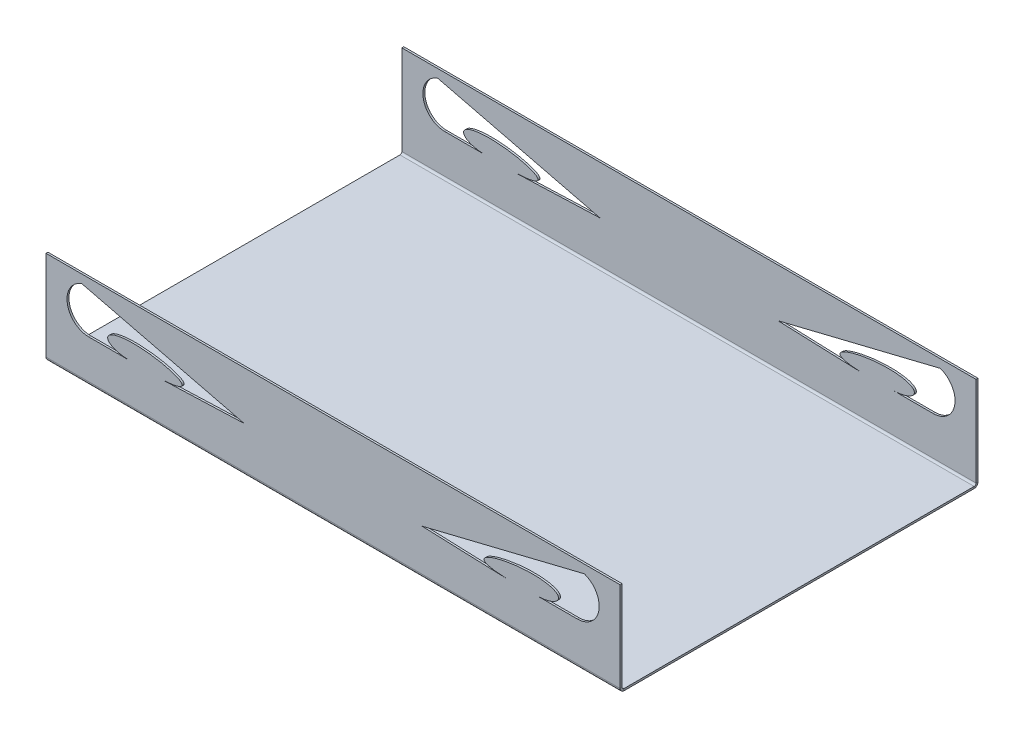
from build123d import *

# Parameters (mm, degrees)
SKETCH1_W                      = 219
SKETCH1_H                      = 135
BASE_FLANGE1_DEPTH             = 0.7366
EDGE_FLANGE1_STRIP_W           = 4.4196
EDGE_FLANGE1_STRIP_H           = 0.7366
EDGE_FLANGE1_STRIP_CUT_DEPTH   = 219
EDGE_FLANGE1_STRIP_2_W         = 4.4196
EDGE_FLANGE1_STRIP_2_H         = 0.7366
EDGE_FLANGE1_STRIP_CUT_2_DEPTH = 219
EDGE_FLANGE1_DEPTH             = 219
EDGE_FLANGE1_BEND_DEPTH        = 219
CUT_EXTRUDE1_DEPTH             = 179.438180663


# Sheet-metal steps are written as plain solids
with BuildPart() as part:
    # Sketch1 → Base-Flange1 (new body)
    with BuildSketch(Plane(origin=(0, 0, 0), x_dir=(1, 0, 0), z_dir=(0, 1, 0))):
        Rectangle(SKETCH1_W, SKETCH1_H)
    extrude(amount=-BASE_FLANGE1_DEPTH)

    # Edge-Flange1 strip (across the edge) → Edge-Flange1 strip cut (cut)
    with BuildSketch(Plane(origin=(-109.5, 0, 67.5), x_dir=(0, 0, -1), z_dir=(1, 0, 0))):
        with Locations((-1.4732, -0.3683)):
            Rectangle(EDGE_FLANGE1_STRIP_W, EDGE_FLANGE1_STRIP_H)
    extrude(amount=EDGE_FLANGE1_STRIP_CUT_DEPTH, mode=Mode.SUBTRACT)

    # Edge-Flange1 strip 2 (across the edge) → Edge-Flange1 strip cut 2 (cut)
    with BuildSketch(Plane(origin=(109.5, 0, -67.5), x_dir=(0, 0, 1), z_dir=(-1, 0, 0))):
        with Locations((-1.4732, -0.3683)):
            Rectangle(EDGE_FLANGE1_STRIP_2_W, EDGE_FLANGE1_STRIP_2_H)
    extrude(amount=EDGE_FLANGE1_STRIP_CUT_2_DEPTH, mode=Mode.SUBTRACT)

    # Edge-Flange1 section (across the edge) → Edge-Flange1 (add)
    with BuildSketch(Plane(origin=(-109.5, 0, 67.5), x_dir=(0, 0, -1), z_dir=(1, 0, 0))):
        with BuildLine():
            Line((-0.7366, 0.7366), (-0.7366, 35))
            Line((-0.7366, 35), (0, 35))
            Line((0, 35), (0, 0.7366))
            ThreePointArc((0, 0.7366), (0.215745145, 0.215745145), (0.7366, 0))
            Line((0.7366, 0), (0.7366, -0.7366))
            ThreePointArc((0.7366, -0.7366), (-0.30510971, -0.30510971), (-0.7366, 0.7366))
        make_face()
    extrude(amount=EDGE_FLANGE1_DEPTH)

    # Edge-Flange1 section 2 (across the edge) → Edge-Flange1 bend (add)
    with BuildSketch(Plane(origin=(109.5, 0, -67.5), x_dir=(0, 0, 1), z_dir=(-1, 0, 0))):
        with BuildLine():
            Line((-0.7366, 0.7366), (-0.7366, 35))
            Line((-0.7366, 35), (0, 35))
            Line((0, 35), (0, 0.7366))
            ThreePointArc((0, 0.7366), (0.215745145, 0.215745145), (0.7366, 0))
            Line((0.7366, 0), (0.7366, -0.7366))
            ThreePointArc((0.7366, -0.7366), (-0.30510971, -0.30510971), (-0.7366, 0.7366))
        make_face()
    extrude(amount=EDGE_FLANGE1_BEND_DEPTH)

    # Sketch13 → Cut-Extrude1 (cut, through all)
    with BuildSketch(Plane.XY.offset(68.2366)):
        with BuildLine():
            Line((77.825189915, 15.538033098), (93.129236627, 15.538033098))
            ThreePointArc((93.129236627, 15.538033098), (101.370995393, 22.515880602), (95.848230578, 31.795751945))
            Line((95.848230578, 31.795751945), (33.918811085, 16.589807391))
            Line((33.918811085, 16.589807391), (66.285317903, 15.384418636))
            add(Edge.make_bspline(
                [(66.285317903, 15.384418636), (33.918811085, 16.589807391), (95.848230578, 31.795751945), (93.129236627, 15.538033098), (77.825189915, 15.538033098)],
                knots=[0, 0, 0, 0, 0, 1, 1, 1, 1, 1], degree=4))
        make_face()
        with BuildLine():
            Line((-95.848230578, 31.795751945), (-33.918811085, 16.589807391))
            Line((-33.918811085, 16.589807391), (-66.285317903, 15.384418636))
            add(Edge.make_bspline(
                [(-66.285317903, 15.384418636), (-33.918811085, 16.589807391), (-95.848230578, 31.795751945), (-93.129236627, 15.538033098), (-77.825189915, 15.538033098)],
                knots=[0, 0, 0, 0, 0, 1, 1, 1, 1, 1], degree=4))
            Line((-77.825189915, 15.538033098), (-93.129236627, 15.538033098))
            ThreePointArc((-93.129236627, 15.538033098), (-101.370995393, 22.515880602), (-95.848230578, 31.795751945))
        make_face()
    extrude(amount=-CUT_EXTRUDE1_DEPTH, mode=Mode.SUBTRACT)


solid = part.part
